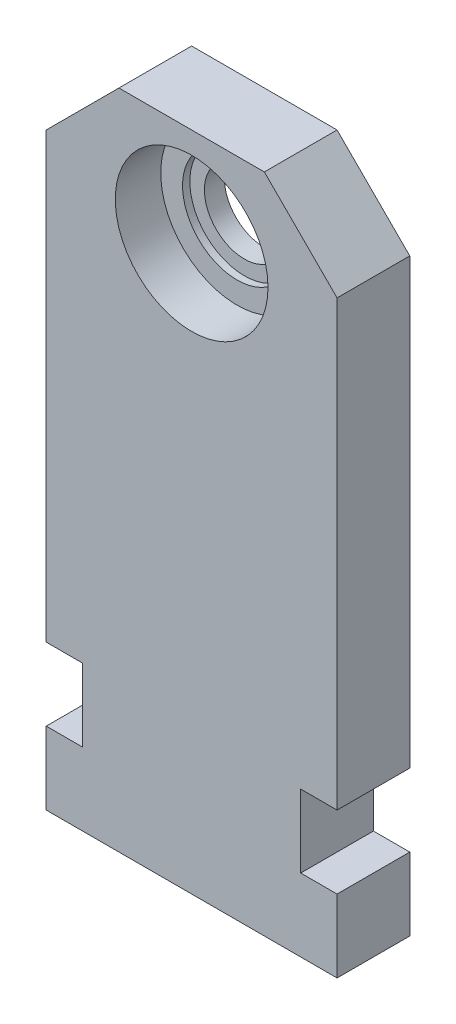
from build123d import *

# Parameters (mm, degrees)
ESQUISSE1_W                  = 80
ESQUISSE1_H                  = 182
BOSS_EXTRU_1_DEPTH           = 20
ENL_V_MAT_EXTRU_1_DEPTH      = 200.809909664
ENL_V_MAT_EXTRU_1_DEPTH_BACK = 200.809909664
ESQUISSE2_R                  = 11
CHANFREIN1_SIZE              = 20
ESQUISSE3_R                  = 21
ENL_V_MAT_EXTRU_2_DEPTH      = 12.5
ESQUISSE4_R                  = 15
ENL_V_MAT_EXTRU_3_DEPTH      = 2
ENL_V_MAT_EXTRU_4_DEPTH      = 200.809909664
ENL_V_MAT_EXTRU_4_DEPTH_BACK = 200.809909664
ESQUISSE5_W                  = 10
ESQUISSE5_H                  = 20


with BuildPart() as part:
    # Esquisse1 → Boss.-Extru.1 (new body)
    with BuildSketch(Plane.XY):
        with Locations((40, 91)):
            Rectangle(ESQUISSE1_W, ESQUISSE1_H)
    extrude(amount=BOSS_EXTRU_1_DEPTH)

    # Esquisse2 → Enlèv. mat.-Extru.1 (cut, two sides: drawn at the far end of the back side and taken through both)
    with BuildSketch(Plane.XY.offset(20).offset(-ENL_V_MAT_EXTRU_1_DEPTH_BACK)):
        with Locations((40, 155)):
            Circle(ESQUISSE2_R)
    extrude(amount=ENL_V_MAT_EXTRU_1_DEPTH + ENL_V_MAT_EXTRU_1_DEPTH_BACK, mode=Mode.SUBTRACT)

    # Chanfrein1
    chanfrein1_edges = [part.edges().sort_by_distance(p)[0] for p in [
        (80, 182, 10),
        (0, 182, 10),
    ]]
    chamfer(chanfrein1_edges, length=CHANFREIN1_SIZE)

    # Esquisse3 → Enlèv. mat.-Extru.2 (cut)
    with BuildSketch(Plane.XY.offset(20)):
        with Locations((40, 155)):
            Circle(ESQUISSE3_R)
    extrude(amount=-ENL_V_MAT_EXTRU_2_DEPTH, mode=Mode.SUBTRACT)

    # Esquisse4 → Enlèv. mat.-Extru.3 (cut)
    with BuildSketch(Plane.XY.offset(7.5)):
        with Locations((40, 155)):
            Circle(ESQUISSE4_R)
    extrude(amount=-ENL_V_MAT_EXTRU_3_DEPTH, mode=Mode.SUBTRACT)

    # Esquisse5 → Enlèv. mat.-Extru.4 (cut, two sides: drawn at the far end of the back side and taken through both)
    with BuildSketch(Plane.XY.offset(20).offset(-ENL_V_MAT_EXTRU_4_DEPTH_BACK)):
        with Locations((75, 30)):
            Rectangle(ESQUISSE5_W, ESQUISSE5_H)
        with Locations((5, 30)):
            Rectangle(ESQUISSE5_W, ESQUISSE5_H)
    extrude(amount=ENL_V_MAT_EXTRU_4_DEPTH + ENL_V_MAT_EXTRU_4_DEPTH_BACK, mode=Mode.SUBTRACT)


solid = part.part
